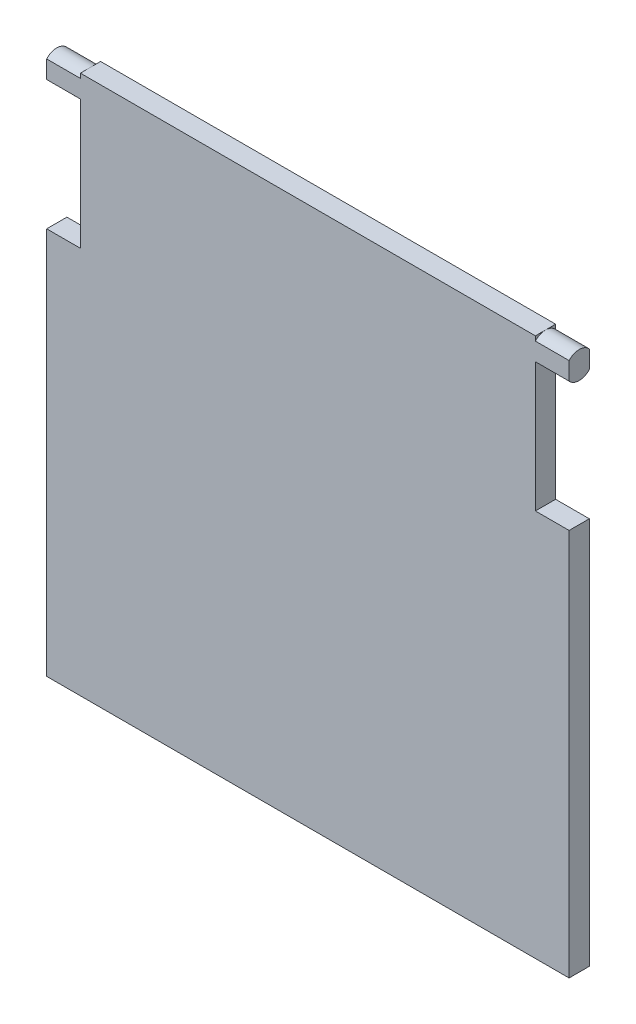
from build123d import *

# Parameters (mm, degrees)
BOSS_EXTRUDE1_DEPTH = 1.2
BOSS_EXTRUDE3_DEPTH = 2


# Read off the part's stored shape, not the designer's step: Boss-Extrude3
with BuildPart() as part:
    # Sketch1 → Boss-Extrude1 (new body)
    with BuildSketch(Plane.XY):
        Polygon((2, 2), (29, 2), (29, -7), (31, -7), (31, -30), (0, -30), (0, -7), (2, -7), align=None)
    extrude(amount=BOSS_EXTRUDE1_DEPTH)

    # Boss-Extrude3 outline → Boss-Extrude3 (add)
    with BuildSketch(Plane(origin=(29, 0, 0), x_dir=(0, 0, -1), z_dir=(1, 0, 0))):
        with BuildLine():
            ThreePointArc((-1.2, 0.670849738), (-0.6, 0.4), (0, 0.670849738))
            Line((0, 0.670849738), (0, 1.729150262))
            ThreePointArc((0, 1.729150262), (-0.6, 2), (-1.2, 1.729150262))
            Line((-1.2, 1.729150262), (-1.2, 0.670849738))
        make_face()
    boss_extrude3 = extrude(amount=BOSS_EXTRUDE3_DEPTH)

    # Mirror1: Boss-Extrude3 across plane
    add(boss_extrude3.mirror(Plane.ZY.offset(-15.5)))


solid = part.part
